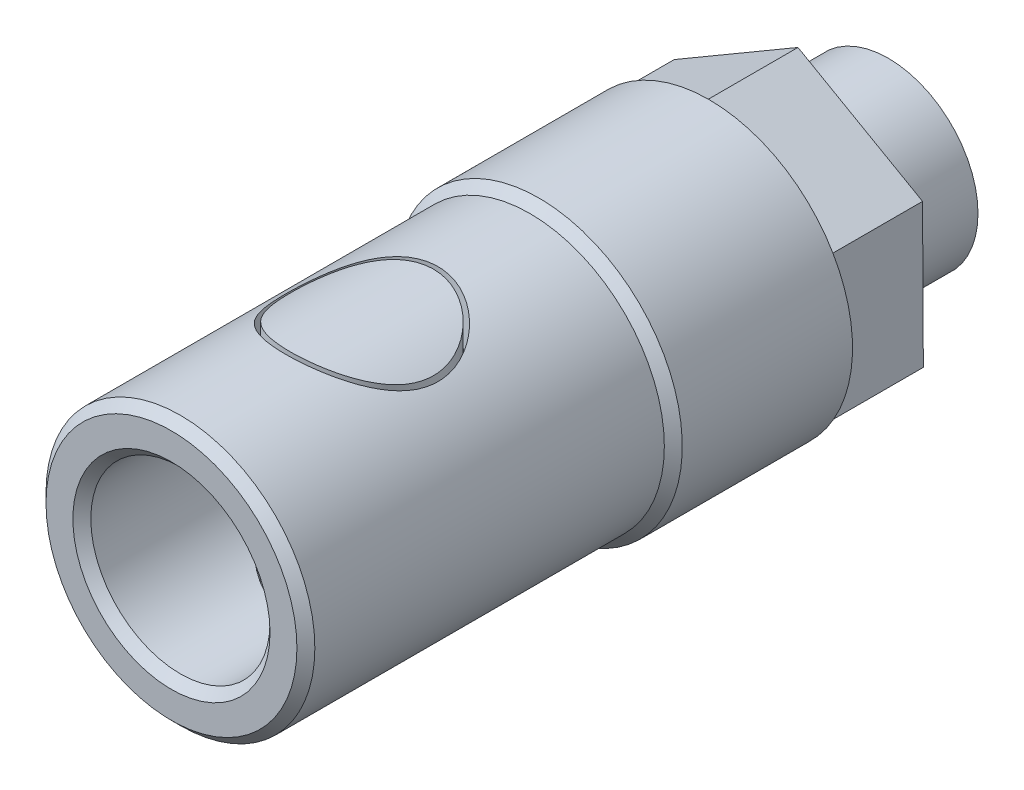
from build123d import *

# Parameters (mm, degrees)
SKETCH1_R               = 15
SKETCH1_R_2             = 10
BOSS_EXTRUDE1_DEPTH     = 40
SKETCH2_R               = 16
SKETCH2_R_2             = 6
EXTRUDE_THIN1_DEPTH     = 20
CHAMFER1_SIZE           = 1
CHAMFER2_SIZE           = 1
SKETCH3_R               = 6
BOSS_EXTRUDE2_DEPTH     = 10
SKETCH4_R               = 10
SKETCH4_R_2             = 6
BOSS_EXTRUDE3_DEPTH     = 10
CUT_EXTRUDE1_DEPTH      = 46.956501172
CUT_EXTRUDE1_DEPTH_BACK = 46.956501172
SKETCH6_R               = 8.493016297
SKETCH6_R_2             = 7.993016297


with BuildPart() as part:
    # Sketch1 → Boss-Extrude1 (new body)
    with BuildSketch(Plane.XY):
        Circle(SKETCH1_R)
        Circle(SKETCH1_R_2, mode=Mode.SUBTRACT)
    extrude(amount=BOSS_EXTRUDE1_DEPTH)

    # Sketch2 → Extrude-Thin1 (add)
    with BuildSketch(Plane(origin=(0, 0, 0), x_dir=(-1, 0, 0), z_dir=(0, 0, -1))):
        Circle(SKETCH2_R)
        Circle(SKETCH2_R_2, mode=Mode.SUBTRACT)
    extrude(amount=EXTRUDE_THIN1_DEPTH)

    # Chamfer1
    chamfer1_edges = [part.edges().sort_by_distance(p)[0] for p in [
        (16, 0, 0),
    ]]
    chamfer(chamfer1_edges, length=CHAMFER1_SIZE - 0.0001)  # a hair under: the kernel refuses the full size

    # Chamfer2
    chamfer2_edges = [part.edges().sort_by_distance(p)[0] for p in [
        (-15, 0, 40),
        (-10, 0, 40),
    ]]
    chamfer(chamfer2_edges, length=CHAMFER2_SIZE)

    # Sketch3 → Boss-Extrude2 (add)
    with BuildSketch(Plane(origin=(0, 0, -20), x_dir=(-1, 0, 0), z_dir=(0, 0, -1))):
        Polygon((13.90062438, 7.92291877), (0.088863263, 15.999753227), (-13.811761117, 8.076834457), (-13.90062438, -7.92291877), (-0.088863263, -15.999753227), (13.811761117, -8.076834457), align=None)
        Circle(SKETCH3_R, mode=Mode.SUBTRACT)
    extrude(amount=BOSS_EXTRUDE2_DEPTH)

    # Sketch4 → Boss-Extrude3 (add)
    with BuildSketch(Plane(origin=(0, 0, -30), x_dir=(-1, 0, 0), z_dir=(0, 0, -1))):
        with Locations(Location((0, 0, 0), (0, 0, 180))):
            Circle(SKETCH4_R)
        Circle(SKETCH4_R_2, mode=Mode.SUBTRACT)
    extrude(amount=BOSS_EXTRUDE3_DEPTH)

    # Sketch6 → Cut-Extrude1 (cut, two sides: drawn at the far end of the back side and taken through both)
    with BuildSketch(Plane(origin=(0, 0, 0), x_dir=(1, 0, 0), z_dir=(0, 1, 0)).offset(-CUT_EXTRUDE1_DEPTH_BACK)):
        with Locations(Location((0, -18.749138454, 0), (0, 0, 270))):
            Circle(SKETCH6_R)
        with Locations(Location((0, -18.749138454, 0), (0, 0, 270))):
            Circle(SKETCH6_R_2, mode=Mode.SUBTRACT)
    extrude(amount=CUT_EXTRUDE1_DEPTH + CUT_EXTRUDE1_DEPTH_BACK, mode=Mode.SUBTRACT)


with BuildPart() as cut_extrude1_piece_1:
    # of the separate pieces the step leaves, piece 1, a body of its own (cut_extrude1_pieces)
    add(part.part.solids().sort_by_distance((15, 0, 39))[0])


with BuildPart() as cut_extrude1_piece_2:
    # of the separate pieces the step leaves, piece 2, a body of its own (cut_extrude1_pieces)
    add(part.part.solids().sort_by_distance((0, -15, 26.742154751))[0])


with BuildPart() as cut_extrude1_piece_3:
    # of the separate pieces the step leaves, piece 3, a body of its own (cut_extrude1_pieces)
    add(part.part.solids().sort_by_distance((0, 15, 26.742154751))[0])


solid = Compound([cut_extrude1_piece_1.part, cut_extrude1_piece_2.part, cut_extrude1_piece_3.part])
